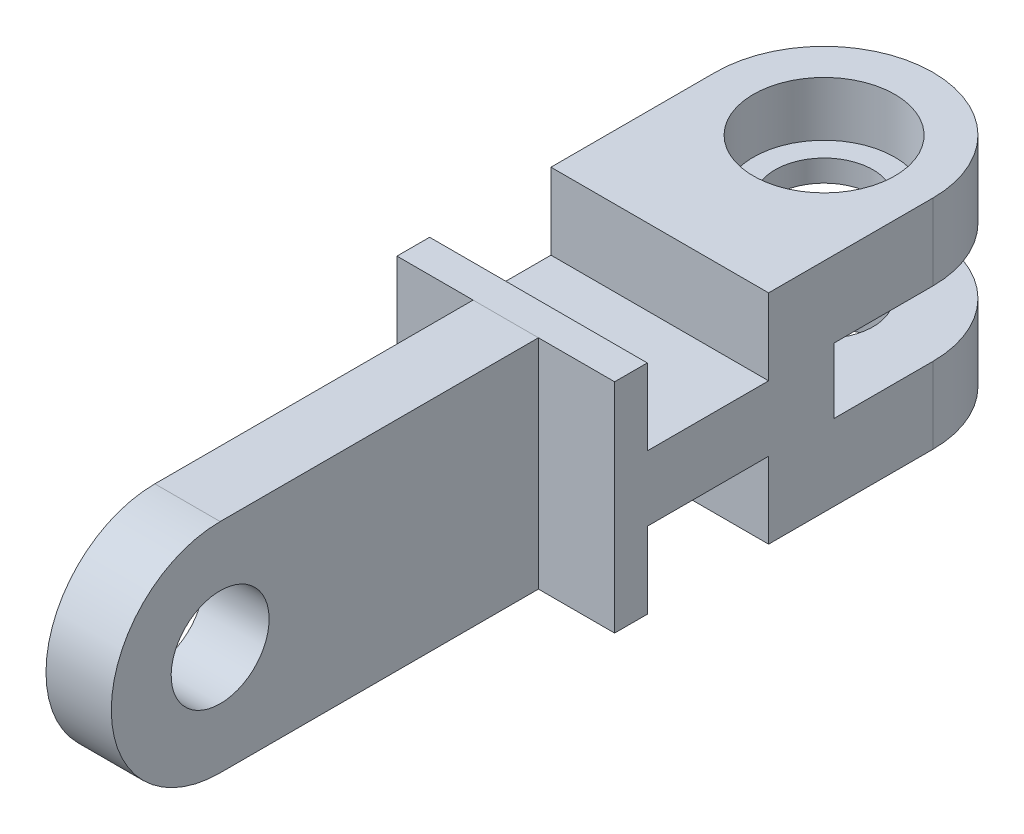
from build123d import *

# Parameters (mm, degrees)
SKETCH_1_W          = 20
SKETCH_1_H          = 20
EXTRUDE_1_DEPTH     = 80.297387422
SKETCH_7_W          = 20
SKETCH_7_H          = 6
SKETCH_7_W_2        = 11.148693711
SKETCH_7_H_2        = 7
CUT_EXTRUDE_6_DEPTH = 34
SKETCH_2_R          = 6.5
CUT_EXTRUDE_1_DEPTH = 5
SKETCH_3_R          = 4.5
CUT_EXTRUDE_2_DEPTH = 29
MOVE_BODY_1_ANGLE   = 90
SKETCH_9_W          = 7
SKETCH_9_H          = 39.245987558
CUT_EXTRUDE_7_DEPTH = 34


# Read off the part's stored shape, not the designer's step: 교차3
with BuildPart() as part:
    # 스케치1 → 보스-돌출1 (new body)
    with BuildSketch(Plane.XY):
        Rectangle(SKETCH_1_W, SKETCH_1_H)
    extrude(amount=EXTRUDE_1_DEPTH)

    # 스케치7 → 컷-돌출6 (cut)
    with BuildSketch(Plane(origin=(10, 0, 0), x_dir=(0, 0, -1), z_dir=(1, 0, 0))):
        with Locations((-10, 0)):
            Rectangle(SKETCH_7_W, SKETCH_7_H)
        with Locations((-31.574346855, 6.5)):
            Rectangle(SKETCH_7_W_2, SKETCH_7_H_2)
        with Locations((-31.574346855, -6.5)):
            Rectangle(SKETCH_7_W_2, SKETCH_7_H_2)
    extrude(amount=-CUT_EXTRUDE_6_DEPTH, mode=Mode.SUBTRACT)

    # 스케치2 → 컷-돌출1 (cut)
    with BuildSketch(Plane(origin=(0, -10, 0), x_dir=(-1, 0, 0), z_dir=(0, -1, 0))):
        with Locations(Location((0, -10.902706153, 0), (0, 0, 90))):
            Circle(SKETCH_2_R)
    cut_extrude_1 = extrude(amount=-CUT_EXTRUDE_1_DEPTH, mode=Mode.SUBTRACT)

    # 대칭 복사7: 컷-돌출1 across plane
    add(cut_extrude_1.mirror(Plane.ZX), mode=Mode.SUBTRACT)

    # 스케치3 → 컷-돌출2 (cut)
    with BuildSketch(Plane(origin=(0, -10, 0), x_dir=(-1, 0, 0), z_dir=(0, -1, 0))):
        with Locations(Location((0, -10.902706153, 0), (0, 0, 270))):
            Circle(SKETCH_3_R)
        with BuildLine():
            Line((-21.262122506, -10.902706153), (-10, -10.902706153))
            ThreePointArc((-10, -10.902706153), (0, -0.902706153), (10, -10.902706153))
            Line((10, -10.902706153), (21.262122506, -10.902706153))
            ThreePointArc((21.262122506, -10.902706153), (0, 10.359416353), (-21.262122506, -10.902706153))
        make_face()
    cut_extrude_2 = extrude(amount=-CUT_EXTRUDE_2_DEPTH, mode=Mode.SUBTRACT)

    # 대칭 복사6: 컷-돌출2 across plane
    add(cut_extrude_2.mirror(Plane.XY.offset(40.148693711)), mode=Mode.SUBTRACT)


with BuildPart() as body_2:
    # 교차3: the piece on the far side of the plane
    add(part.part)
    split(bisect_by=Plane.XY.offset(40.148693711), keep=Keep.BOTTOM)


with BuildPart() as part_1:
    add(part.part)

    # 교차3
    split(bisect_by=Plane.XY.offset(40.148693711), keep=Keep.TOP)


with BuildPart() as part_2:
    # Move Body 1: moved
    add(part_1.part.rotate(Axis((0, 0, 0), (0, 0, 1)), MOVE_BODY_1_ANGLE))

    # 스케치9 → 컷-돌출7 (cut)
    with BuildSketch(Plane.XZ.offset(10)):
        with Locations((6.5, 59.77168749)):
            Rectangle(SKETCH_9_W, SKETCH_9_H)
        with Locations((-6.5, 59.77168749)):
            Rectangle(SKETCH_9_W, SKETCH_9_H)
    extrude(amount=-CUT_EXTRUDE_7_DEPTH, mode=Mode.SUBTRACT)


solid = Compound([body_2.part, part_2.part])
